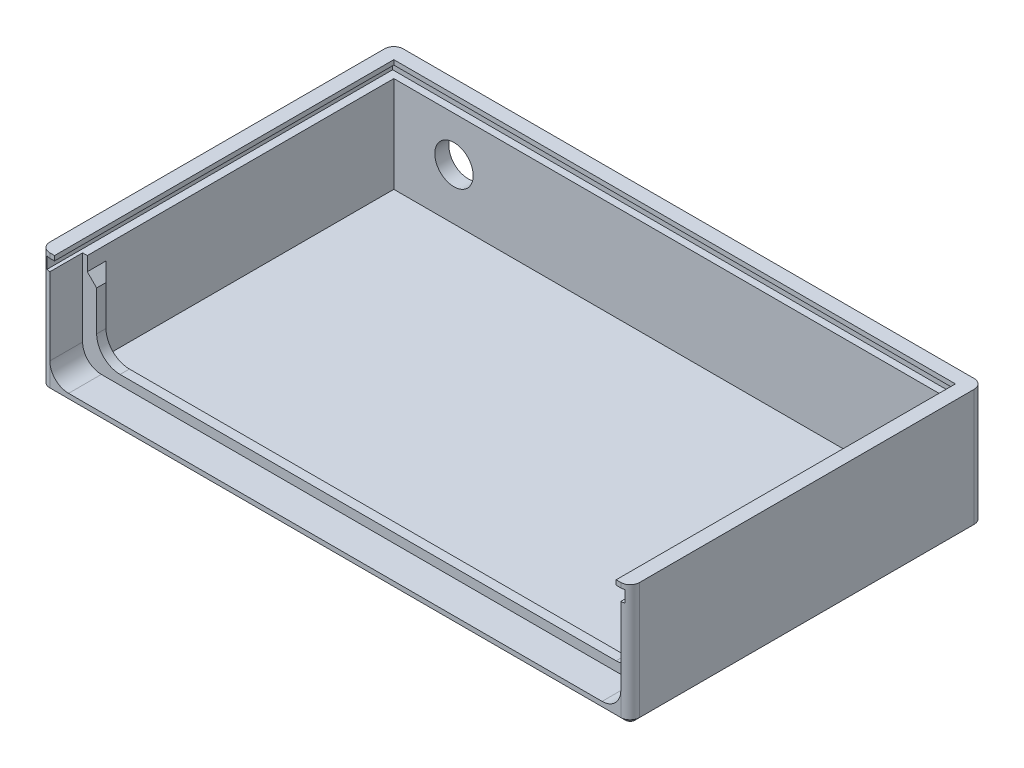
from build123d import *

# Parameters (mm, degrees)
ESQUISSE1_W                     = 126
ESQUISSE1_H                     = 75.5
BOSS_EXTRU_1_DEPTH              = 2
BOSS_EXTRU_2_DEPTH              = 24
ESQUISSE3_W                     = 123.5
ESQUISSE3_H                     = 74
ENL_V_MAT_EXTRU_1_DEPTH         = 2.5
BOSS_EXTRU_3_START              = -7
BOSS_EXTRU_3_DEPTH              = 2
ESQUISSE5_W                     = 1
ESQUISSE5_H                     = 20.5
ENL_V_MAT_EXTRU_2_DEPTH         = 7
D_POUILLE1_ANGLE                = 45
D_POUILLE1_OF_SYM_TRIE1_2_ANGLE = 45
ENL_V_MAT_EXTRU_3_REACH         = 103.712
ESQUISSE6_R                     = 4.1
CONG_1_R                        = 4
CONG_2_R                        = 2
CHANFREIN1_SIZE                 = 1
ESQUISSE7_W                     = 1.435897436
ESQUISSE7_H                     = 8
ENL_V_MAT_EXTRU_4_DEPTH         = 0.5
CHANFREIN2_SIZE                 = 2


# Some blends are built 0.0001 mm under size
with BuildPart() as part:
    # Esquisse1 → Boss.-Extru.1 (new body)
    with BuildSketch(Plane(origin=(0, 0, 0), x_dir=(1, 0, 0), z_dir=(0, 1, 0))):
        Rectangle(ESQUISSE1_W, ESQUISSE1_H)
    extrude(amount=BOSS_EXTRU_1_DEPTH)

    # Esquisse2 → Boss.-Extru.2 (add)
    with BuildSketch(Plane(origin=(0, 2, 0), x_dir=(1, 0, 0), z_dir=(0, 1, 0))):
        Polygon((-63, -37.75), (-63, 37.75), (63, 37.75), (63, -37.75), (60, -37.75), (60, 34.75), (-60, 34.75), (-60, -37.75), align=None)
    extrude(amount=BOSS_EXTRU_2_DEPTH)

    # Esquisse3 → Enlèv. mat.-Extru.1 (cut)
    with BuildSketch(Plane(origin=(0, 25, 0), x_dir=(1, 0, 0), z_dir=(0, 1, 0))):
        with Locations((0, -0.75)):
            Rectangle(ESQUISSE3_W, ESQUISSE3_H)
    extrude(amount=-ENL_V_MAT_EXTRU_1_DEPTH, mode=Mode.SUBTRACT)

    # Esquisse4 → Boss.-Extru.3 (add)
    with BuildSketch(Plane.XY.offset(37.75).offset(BOSS_EXTRU_3_START)):
        with BuildLine():
            Line((-60, 2), (-60, 17.5))
            Line((-60, 17.5), (-58, 17.5))
            Line((-58, 17.5), (-58, 9))
            ThreePointArc((-58, 9), (-56.535533906, 5.464466094), (-53, 4))
            Line((-53, 4), (0, 4))
            Line((0, 4), (0, 2))
            Line((0, 2), (-60, 2))
        make_face()
    boss_extru_3 = extrude(amount=-BOSS_EXTRU_3_DEPTH)

    # Esquisse5 → Enlèv. mat.-Extru.2 (cut)
    with BuildSketch(Plane.XY.offset(37.75)):
        with Locations((-60.5, 12.25)):
            Rectangle(ESQUISSE5_W, ESQUISSE5_H)
    enl_v_mat_extru_2 = extrude(amount=-ENL_V_MAT_EXTRU_2_DEPTH, mode=Mode.SUBTRACT)

    # Dépouille1
    d_pouille1_faces = [part.faces().sort_by_distance(p)[0] for p in [
        (-59, 17.5, 29.75),
    ]]
    draft(d_pouille1_faces, Plane(origin=(-58, 17.5, 28.75), x_dir=(0, 1, 0), z_dir=(1, 0, 0)), D_POUILLE1_ANGLE)

    # Symétrie1: Boss.-Extru.3, Enlèv. mat.-Extru.2 across plane
    add(boss_extru_3.mirror(Plane(origin=(0, 0, 0), x_dir=(0, 0, 1), z_dir=(1, 0, 0))))
    add(enl_v_mat_extru_2.mirror(Plane(origin=(0, 0, 0), x_dir=(0, 0, 1), z_dir=(1, 0, 0))), mode=Mode.SUBTRACT)

    # Dépouille1 of Sym_trie1 2
    d_pouille1_of_sym_trie1_2_faces = [part.faces().sort_by_distance(p)[0] for p in [
        (59, 17.5, 29.75),
    ]]
    draft(d_pouille1_of_sym_trie1_2_faces, Plane(origin=(58, 17.5, 28.75), x_dir=(0, 1, 0), z_dir=(-1, 0, 0)), D_POUILLE1_OF_SYM_TRIE1_2_ANGLE)

    # Esquisse6 → Enlèv. mat.-Extru.3 (cut, up to next)
    with BuildSketch(Plane(origin=(0, 0, -37.75), x_dir=(-1, 0, 0), z_dir=(0, 0, -1)), mode=Mode.PRIVATE) as enl_v_mat_extru_3_sk1:
        with Locations((47.15, 13)):
            Circle(ESQUISSE6_R)
    enl_v_mat_extru_3_tool1 = extrude(enl_v_mat_extru_3_sk1.sketch, amount=-ENL_V_MAT_EXTRU_3_REACH, mode=Mode.PRIVATE) & part.part
    add(enl_v_mat_extru_3_tool1.solids().sort_by_distance((-47.15, 13, -37.75))[0], mode=Mode.SUBTRACT)

    # Congé1
    cong_1_edges = [part.edges().sort_by_distance(p)[0] for p in [
        (61, 2, 34.25),
        (-61, 2, 34.25),
    ]]
    fillet(cong_1_edges, radius=CONG_1_R)

    # Congé2
    # the kernel refuses this fillet: 2 mm, written as the material it takes off along each edge
    with BuildSketch(Plane(origin=(-63, 31, -37.75), x_dir=(0, 0, 1), z_dir=(0, -1, 0)), Plane(origin=(-63, 31, 37.75), x_dir=(1, 0, 0), z_dir=(0, -1, 0)), Plane(origin=(63, -5, 37.75), x_dir=(-1, 0, 0), z_dir=(0, 1, 0)), Plane(origin=(63, -5, -37.75), x_dir=(0, 0, 1), z_dir=(0, 1, 0))) as cong_2_piece_1:
        with BuildLine():
            CenterArc((CONG_2_R, -CONG_2_R), CONG_2_R, 90, 90)
            Line((0, -CONG_2_R), (0, 0))
            Line((0, 0), (CONG_2_R, 0))
        make_face()
    extrude(amount=36, mode=Mode.SUBTRACT)

    # Chanfrein1
    chanfrein1_edges = [part.edges().sort_by_distance(p)[0] for p in [
        (-63, 0, 0),
        (63, 0, 0),
        (0, 0, 37.75),
        (0, 0, -37.75),
        (62.414213562, 0, -37.164213562),
        (62.414213562, 0, 37.164213562),
        (-62.414213562, 0, 37.164213562),
        (-62.414213562, 0, -37.164213562),
    ]]
    chamfer(chanfrein1_edges, length=CHANFREIN1_SIZE)

    # Esquisse7 → Enlèv. mat.-Extru.4 (cut)
    # profile 1 of 6: a face of its own
    with BuildSketch(Plane(origin=(0, 0, -37.75), x_dir=(-1, 0, 0), z_dir=(0, 0, -1))):
        with BuildLine():
            Line((37.356730769, 9.1), (33.714102564, 9.1))
            Line((33.714102564, 9.1), (33.714102564, 10.433333333))
            Line((33.714102564, 10.433333333), (36.218910256, 10.433333333))
            Line((36.218910256, 10.433333333), (36.531410256, 11.946153846))
            add(Edge.make_bspline(
                [(36.531410256, 11.946153846), (36.488833773, 11.934258819), (36.404358361, 11.910658061), (36.277741523, 11.887776157), (36.155195684, 11.872131812), (36.075259219, 11.870182715), (36.036217949, 11.869230769)],
                knots=[0, 0, 0, 0, 1.054652254, 2.092520994, 3.068380062, 4, 4, 4, 4], degree=3))
            add(Edge.make_bspline(
                [(36.036217949, 11.869230769), (35.951152034, 11.871180005), (35.783468376, 11.875022379), (35.538168463, 11.91149904), (35.303279305, 11.968948675), (35.079519689, 12.050883709), (34.867108199, 12.15752427), (34.665787349, 12.286529457), (34.475310053, 12.438125847), (34.299059989, 12.612408354), (34.137114067, 12.803774493), (33.996311325, 13.010757222), (33.876056996, 13.230405166), (33.780410861, 13.464083654), (33.704918777, 13.710325028), (33.650366511, 13.969287087), (33.618107031, 14.241276738), (33.613757038, 14.426835831), (33.611538462, 14.521474359)],
                knots=[0, 0, 0, 0, 1.01440847, 1.999622559, 2.951875003, 3.895578053, 4.836219714, 5.782137149, 6.743708247, 7.735272588, 8.734977101, 9.730283169, 10.717124674, 11.717316708, 12.737475749, 13.78628267, 14.87096371, 16, 16, 16, 16], degree=3))
            add(Edge.make_bspline(
                [(33.611538462, 14.521474359), (33.61423569, 14.617191997), (33.619558109, 14.806070878), (33.654660737, 15.083707767), (33.715573847, 15.350102599), (33.802710091, 15.60364258), (33.912669136, 15.84618458), (34.045376918, 16.078023706), (34.205799473, 16.296577848), (34.387369568, 16.501740887), (34.585480049, 16.689417979), (34.796961736, 16.854081108), (35.018239767, 16.995095781), (35.252451476, 17.106937081), (35.496013236, 17.195869357), (35.749770965, 17.260470864), (36.014819144, 17.297547665), (36.194757565, 17.302573592), (36.286217949, 17.305128205)],
                knots=[0, 0, 0, 0, 1.068252361, 2.107974174, 3.117445057, 4.112928197, 5.094821713, 6.085741881, 7.08864209, 8.115013732, 9.139860459, 10.12970393, 11.102304324, 12.062250553, 13.020362151, 13.992066755, 14.979393365, 16, 16, 16, 16], degree=3))
            add(Edge.make_bspline(
                [(36.286217949, 17.305128205), (36.36799199, 17.302969417), (36.529267512, 17.298711834), (36.76719768, 17.274341519), (36.995390922, 17.225942312), (37.216097107, 17.16517851), (37.426264805, 17.081419043), (37.630224837, 16.9851656), (37.821837302, 16.864321235), (38.006545818, 16.731193572), (38.177249589, 16.580001734), (38.335743072, 16.416624509), (38.475997296, 16.238007931), (38.603237632, 16.047623622), (38.710550731, 15.841916713), (38.80648242, 15.624587445), (38.884853003, 15.393189509), (38.924648228, 15.232793715), (38.944871795, 15.151282051)],
                knots=[0, 0, 0, 0, 1.055144606, 2.080965977, 3.079696235, 4.061281178, 5.030010203, 5.994686618, 6.966205752, 7.947572972, 8.929036963, 9.903776773, 10.879904045, 11.854643856, 12.853445432, 13.868704235, 14.916895142, 16, 16, 16, 16], degree=3))
            Line((38.944871795, 15.151282051), (37.303846154, 15.151282051))
            add(Edge.make_bspline(
                [(37.303846154, 15.151282051), (37.273862704, 15.20778795), (37.215593291, 15.317600716), (37.104497814, 15.463060755), (36.981001682, 15.588430378), (36.841822396, 15.689021011), (36.694351878, 15.769646198), (36.53826871, 15.828803733), (36.373697012, 15.862791061), (36.261263072, 15.867070019), (36.204487179, 15.869230769)],
                knots=[0, 0, 0, 0, 1.105237818, 2.14790357, 3.154462025, 4.139874369, 5.10774607, 6.055457142, 7.018062016, 8, 8, 8, 8], degree=3))
            add(Edge.make_bspline(
                [(36.204487179, 15.869230769), (36.164916494, 15.867741448), (36.087060502, 15.864811183), (35.97234664, 15.849321136), (35.862867968, 15.819945225), (35.757711891, 15.779394631), (35.656566336, 15.72815206), (35.5599408, 15.665191759), (35.468319558, 15.590909822), (35.382007933, 15.50650921), (35.304103317, 15.412176887), (35.235192219, 15.311477004), (35.176242977, 15.204497286), (35.130421826, 15.09005829), (35.093445527, 14.969432147), (35.066054036, 14.842467008), (35.049723167, 14.708871045), (35.048208532, 14.617674403), (35.047435897, 14.571153846)],
                knots=[0, 0, 0, 0, 0.978584799, 1.925382083, 2.854237347, 3.773848163, 4.706917643, 5.651871472, 6.619075428, 7.618203006, 8.630937754, 9.638147826, 10.630884984, 11.643619732, 12.679505692, 13.746568031, 14.850495961, 16, 16, 16, 16], degree=3))
            add(Edge.make_bspline(
                [(35.047435897, 14.571153846), (35.048084262, 14.525678449), (35.049347218, 14.437096436), (35.067212935, 14.307735078), (35.089600071, 14.18389614), (35.125789711, 14.066738516), (35.169943509, 13.954952988), (35.227667349, 13.851133704), (35.29032401, 13.750515153), (35.366642118, 13.660425433), (35.447268049, 13.577000872), (35.534271503, 13.504440158), (35.62572548, 13.44335686), (35.721534266, 13.393457669), (35.82080087, 13.352112104), (35.925769876, 13.326416259), (36.033886304, 13.306803055), (36.107703766, 13.305692305), (36.145192308, 13.305128205)],
                knots=[0, 0, 0, 0, 1.166510573, 2.272258428, 3.34817395, 4.393855846, 5.415148486, 6.427654656, 7.43960333, 8.452852352, 9.451798603, 10.415864797, 11.355425197, 12.269514664, 13.186377996, 14.107845883, 15.039060727, 16, 16, 16, 16], degree=3))
            add(Edge.make_bspline(
                [(36.145192308, 13.305128205), (36.185920887, 13.30663108), (36.267549696, 13.309643163), (36.388408684, 13.335439705), (36.508876077, 13.373621269), (36.627384677, 13.43063288), (36.745049016, 13.503782002), (36.862071637, 13.592158908), (36.977979167, 13.697176188), (37.051215208, 13.775715333), (37.089102564, 13.816346154)],
                knots=[0, 0, 0, 0, 0.882519632, 1.768758668, 2.670168731, 3.618680561, 4.612333577, 5.671392632, 6.795336641, 8, 8, 8, 8], degree=3))
            Line((37.089102564, 13.816346154), (38.297435897, 13.539102564))
            Line((38.297435897, 13.539102564), (37.356730769, 9.1))
        make_face()
    # profile 2 of 6: a face of its own
    with BuildSketch(Plane(origin=(0, 0, -37.75), x_dir=(-1, 0, 0), z_dir=(0, 0, -1))):
        Polygon((32.73974359, 9.1), (31.206089744, 9.1), (29.15, 14.782692308), (27.089102564, 9.1), (25.56025641, 9.1), (28.460897436, 17.1), (29.843910256, 17.1), align=None)
    # profile 3 of 6: a face of its own
    with BuildSketch(Plane(origin=(0, 0, -37.75), x_dir=(-1, 0, 0), z_dir=(0, 0, -1))):
        with BuildLine():
            Line((21.201282051, 9.1), (19.391987179, 9.1))
            add(Edge.make_bspline(
                [(19.391987179, 9.1), (19.250928398, 9.100963267), (18.97826018, 9.102825273), (18.58327372, 9.124607525), (18.215711922, 9.156593782), (17.876406268, 9.205547307), (17.564134897, 9.262365527), (17.281202856, 9.338457195), (17.025307529, 9.425778932), (16.793763304, 9.527520805), (16.582963289, 9.64684047), (16.384221103, 9.780891164), (16.195242375, 9.931683963), (16.014979821, 10.099569895), (15.842994139, 10.283432692), (15.683322548, 10.486974584), (15.530846093, 10.704923565), (15.388038718, 10.938036083), (15.260922318, 11.185851914), (15.147774471, 11.444470615), (15.053501878, 11.714060272), (14.976741786, 11.994248651), (14.91559813, 12.284224111), (14.872806328, 12.584539165), (14.846354743, 12.894924791), (14.84367125, 13.105288029), (14.842307692, 13.212179487)],
                knots=[0, 0, 0, 0, 1.44349102, 2.790284463, 4.047513061, 5.218094321, 6.297837468, 7.293772999, 8.213586047, 9.062895527, 9.878013142, 10.689252941, 11.514048747, 12.349645483, 13.208421871, 14.087867281, 14.994836234, 15.929653487, 16.883274053, 17.843080533, 18.816554169, 19.803369425, 20.81449504, 21.847452076, 22.906230055, 24, 24, 24, 24], degree=3))
            add(Edge.make_bspline(
                [(14.842307692, 13.212179487), (14.845877862, 13.363010491), (14.852905949, 13.65993015), (14.912113033, 14.095653639), (15.00785532, 14.513348388), (15.142532169, 14.909698807), (15.309306256, 15.281348776), (15.509038814, 15.620853503), (15.735992407, 15.928905025), (15.992180982, 16.200392134), (16.2691327, 16.435167669), (16.558068698, 16.633893498), (16.858730483, 16.793407194), (17.12421356, 16.893019288), (17.355068893, 16.955625897), (17.557457555, 16.991996147), (17.787793352, 17.025728063), (18.046944407, 17.054721537), (18.335679218, 17.074576338), (18.653103684, 17.088287479), (18.999294687, 17.098475729), (19.239735381, 17.099478596), (19.36474359, 17.1)],
                knots=[0, 0, 0, 0, 1.315347898, 2.589339334, 3.828278609, 5.048487211, 6.235212834, 7.375728391, 8.47833097, 9.56625089, 10.624194351, 11.640157642, 12.619895326, 13.585848527, 14.106971868, 14.704705962, 15.37825295, 16.137840974, 16.978850452, 17.902510282, 18.909488129, 20, 20, 20, 20], degree=3))
            Line((19.36474359, 17.1), (21.201282051, 17.1))
            Line((21.201282051, 17.1), (21.201282051, 9.1))
        make_face()
        with BuildLine():
            Line((19.765384615, 10.535897436), (19.765384615, 15.664102564))
            Line((19.765384615, 15.664102564), (19.015384615, 15.664102564))
            add(Edge.make_bspline(
                [(19.015384615, 15.664102564), (18.926161605, 15.66367051), (18.754582041, 15.662839652), (18.506557335, 15.65142376), (18.277664266, 15.632885708), (18.067603014, 15.605465137), (17.875890664, 15.572471171), (17.703226529, 15.531661984), (17.549270293, 15.482034905), (17.412752367, 15.42354889), (17.288114513, 15.35677413), (17.172647625, 15.278801799), (17.06120799, 15.192149814), (16.955855328, 15.094348095), (16.856197079, 14.986670444), (16.762822562, 14.868567605), (16.674480126, 14.740399688), (16.593460083, 14.601483949), (16.51935366, 14.453308792), (16.453882557, 14.297225895), (16.398612959, 14.132384365), (16.356641084, 13.958857167), (16.320886577, 13.777721114), (16.295069081, 13.587811557), (16.281003621, 13.389748942), (16.279147054, 13.254935741), (16.278205128, 13.186538462)],
                knots=[0, 0, 0, 0, 1.502729547, 2.8898115, 4.181010027, 5.369596896, 6.45687185, 7.456390247, 8.355533714, 9.177830239, 9.954819978, 10.733423081, 11.521791071, 12.330436719, 13.151797389, 13.990712567, 14.864234656, 15.771624029, 16.697123225, 17.652960569, 18.620374037, 19.622036587, 20.657870943, 21.729319508, 22.8479736, 24, 24, 24, 24], degree=3))
            add(Edge.make_bspline(
                [(16.278205128, 13.186538462), (16.280111706, 13.081729597), (16.283829385, 12.877360432), (16.319905992, 12.579732025), (16.378035933, 12.299821084), (16.462715189, 12.038346672), (16.566848532, 11.793646482), (16.699256253, 11.568873781), (16.851894569, 11.360344303), (16.972666573, 11.238036646), (17.033012821, 11.176923077)],
                knots=[0, 0, 0, 0, 1.138242922, 2.219485503, 3.251901297, 4.239342788, 5.201071, 6.134757343, 7.067992642, 8, 8, 8, 8], degree=3))
            add(Edge.make_bspline(
                [(17.033012821, 11.176923077), (17.092514979, 11.124844288), (17.214041399, 11.018479257), (17.427401857, 10.89102675), (17.662514032, 10.779047229), (17.924756586, 10.690259958), (18.21159506, 10.620043199), (18.52473787, 10.571616417), (18.862508068, 10.54049788), (19.096507392, 10.537463771), (19.217307692, 10.535897436)],
                knots=[0, 0, 0, 0, 0.813307809, 1.661089106, 2.549956539, 3.493439533, 4.508053171, 5.589449661, 6.755572447, 8, 8, 8, 8], degree=3))
            Line((19.217307692, 10.535897436), (19.765384615, 10.535897436))
        make_face(mode=Mode.SUBTRACT)
    # profile 4 of 6: a face of its own
    with BuildSketch(Plane(origin=(0, 0, -37.75), x_dir=(-1, 0, 0), z_dir=(0, 0, -1))):
        with BuildLine():
            Line((6.226923077, 10.487820513), (7.279807692, 11.494230769))
            add(Edge.make_bspline(
                [(7.279807692, 11.494230769), (7.369017984, 11.401745077), (7.543557296, 11.220797467), (7.826143158, 10.983917342), (8.116653022, 10.782598967), (8.415900017, 10.618510179), (8.72371224, 10.488287999), (9.040625228, 10.397445062), (9.365873469, 10.34024497), (9.585661669, 10.333945363), (9.696474359, 10.330769231)],
                knots=[0, 0, 0, 0, 1.115370381, 2.182214363, 3.196266025, 4.180416361, 5.141116029, 6.092551847, 7.038303877, 8, 8, 8, 8], degree=3))
            add(Edge.make_bspline(
                [(9.696474359, 10.330769231), (9.789004122, 10.333327683), (9.971601415, 10.338376508), (10.239676758, 10.375478563), (10.496201903, 10.438334239), (10.741380372, 10.525703172), (10.976424352, 10.635729955), (11.199145169, 10.774025688), (11.410739747, 10.935974584), (11.608735778, 11.121293253), (11.787483364, 11.32526574), (11.94853748, 11.540085334), (12.081937484, 11.769551672), (12.190831758, 12.010318432), (12.276642948, 12.262472556), (12.337546594, 12.526001422), (12.372834207, 12.801500032), (12.378095359, 12.988788732), (12.380769231, 13.083974359)],
                knots=[0, 0, 0, 0, 1.035268443, 2.04298821, 3.02163646, 3.985902049, 4.951223231, 5.920091634, 6.913651787, 7.92868536, 8.949353712, 9.945284791, 10.92850487, 11.913014323, 12.897904816, 13.904240668, 14.934873455, 16, 16, 16, 16], degree=3))
            add(Edge.make_bspline(
                [(12.380769231, 13.083974359), (12.379987651, 13.150780332), (12.378447141, 13.282456277), (12.362008991, 13.476741091), (12.3347092, 13.665650917), (12.296419083, 13.848626038), (12.248215086, 14.026455768), (12.189217982, 14.197981809), (12.117884815, 14.363424231), (12.038051153, 14.523649669), (11.948939732, 14.67730046), (11.849049917, 14.822339036), (11.739501045, 14.957638388), (11.624676559, 15.087906461), (11.496971887, 15.205519772), (11.362104816, 15.316960157), (11.218140264, 15.419466841), (11.06525306, 15.511613302), (10.908006713, 15.597492204), (10.743179003, 15.668610998), (10.575375862, 15.732542559), (10.401653457, 15.780638328), (10.225071902, 15.82247148), (10.043173344, 15.848020288), (9.857684069, 15.867434003), (9.732318933, 15.868629269), (9.669230769, 15.869230769)],
                knots=[0, 0, 0, 0, 1.103833241, 2.175677997, 3.219414644, 4.256521947, 5.263082927, 6.262573145, 7.25136242, 8.238376666, 9.219530388, 10.184343756, 11.145312504, 12.095474572, 13.051075647, 14.010745898, 14.985684176, 15.968306307, 16.959653902, 17.943861036, 18.93268972, 19.924626761, 20.920484516, 21.929288403, 22.957944781, 24, 24, 24, 24], degree=3))
            add(Edge.make_bspline(
                [(9.669230769, 15.869230769), (9.562220533, 15.866142538), (9.351973246, 15.860074966), (9.043450591, 15.812420272), (8.748612847, 15.734383783), (8.513500914, 15.640521186), (8.329536999, 15.549273334), (8.189559912, 15.466079872), (8.045424092, 15.371845125), (7.898116392, 15.263958642), (7.746839422, 15.143704323), (7.594191996, 15.008568702), (7.436287283, 14.862966943), (7.332844647, 14.759049584), (7.279807692, 14.705769231)],
                knots=[0, 0, 0, 0, 1.404640003, 2.759752344, 4.088613405, 5.401587939, 6.076032573, 6.783413463, 7.538272532, 8.336594406, 9.180107851, 10.074881764, 11.012956238, 12, 12, 12, 12], degree=3))
            Line((7.279807692, 14.705769231), (6.258974359, 15.777884615))
            add(Edge.make_bspline(
                [(6.258974359, 15.777884615), (6.330733447, 15.847165765), (6.47079184, 15.982387754), (6.682066052, 16.174390314), (6.893074313, 16.346926128), (7.09871935, 16.506256701), (7.302368969, 16.64774306), (7.504004603, 16.771517046), (7.701333104, 16.880742219), (7.898489144, 16.973461505), (8.097037763, 17.05269227), (8.301237327, 17.119511581), (8.511185404, 17.17784026), (8.728620793, 17.223741922), (8.952573318, 17.261109052), (9.183762617, 17.285800429), (9.4211085, 17.302922346), (9.58159228, 17.304386918), (9.662820513, 17.305128205)],
                knots=[0, 0, 0, 0, 1.244537013, 2.429070097, 3.56066612, 4.644477994, 5.67429546, 6.652817684, 7.595405349, 8.486886006, 9.369351459, 10.26090686, 11.166404474, 12.086719576, 13.0323422, 13.998023148, 14.9867073, 16, 16, 16, 16], degree=3))
            add(Edge.make_bspline(
                [(9.662820513, 17.305128205), (9.812020965, 17.301318066), (10.103964776, 17.293862684), (10.531842067, 17.238813508), (10.938651229, 17.14591522), (11.325123236, 17.016316299), (11.690075322, 16.848032792), (12.034651985, 16.64384009), (12.358279395, 16.401800187), (12.658172774, 16.125519253), (12.929355609, 15.820325962), (13.169320794, 15.492757665), (13.366946962, 15.14046201), (13.534622609, 14.770985398), (13.660270035, 14.378551482), (13.751730286, 13.966706355), (13.807383373, 13.533682649), (13.813531223, 13.237986461), (13.816666667, 13.087179487)],
                knots=[0, 0, 0, 0, 1.07798487, 2.109316747, 3.111276023, 4.08905949, 5.049398091, 6.009992678, 6.978127636, 7.964347882, 8.951383687, 9.924270623, 10.892397886, 11.86520058, 12.851549246, 13.863953586, 14.910602472, 16, 16, 16, 16], degree=3))
            add(Edge.make_bspline(
                [(13.816666667, 13.087179487), (13.815297273, 12.98882865), (13.81258347, 12.793921327), (13.785829887, 12.506062494), (13.744788723, 12.226616271), (13.686377511, 11.955926354), (13.613750922, 11.693055493), (13.521307776, 11.439193885), (13.414234874, 11.192951802), (13.289228419, 10.956624013), (13.149102854, 10.729911873), (12.995907718, 10.513388437), (12.82669297, 10.309207361), (12.643066625, 10.116475619), (12.446554791, 9.933947526), (12.235235595, 9.762918499), (12.008906978, 9.604491462), (11.769877566, 9.458536212), (11.522697955, 9.324496463), (11.267192477, 9.212104467), (11.008340439, 9.112889589), (10.744387976, 9.032751567), (10.474754122, 8.972303257), (10.201497862, 8.926687019), (9.922386507, 8.901156618), (9.734984096, 8.896980082), (9.640384615, 8.894871795)],
                knots=[0, 0, 0, 0, 1.07193642, 2.124315995, 3.14887099, 4.149444713, 5.141371803, 6.119544533, 7.092241254, 8.06650569, 9.031360777, 9.996057679, 10.955696533, 11.919602115, 12.89624813, 13.877605408, 14.880920851, 15.905674436, 16.929600311, 17.943674756, 18.946313929, 19.950355855, 20.947755382, 21.956851243, 22.968632213, 24, 24, 24, 24], degree=3))
            add(Edge.make_bspline(
                [(9.640384615, 8.894871795), (9.559682171, 8.896081836), (9.399116362, 8.898489337), (9.160000338, 8.918523009), (8.922822828, 8.950075019), (8.688308098, 8.997347624), (8.455401547, 9.054596925), (8.225078294, 9.125112609), (7.997973462, 9.211125217), (7.772118232, 9.306273312), (7.552016949, 9.414594479), (7.339582443, 9.535838799), (7.13428834, 9.666834406), (6.937372221, 9.809834445), (6.747447122, 9.962738431), (6.564715689, 10.125541303), (6.390931369, 10.301196263), (6.281868884, 10.425297942), (6.226923077, 10.487820513)],
                knots=[0, 0, 0, 0, 0.996333415, 1.982307736, 2.96084097, 3.949129141, 4.93457382, 5.921430247, 6.92116383, 7.931890485, 8.946633814, 9.948019707, 10.950686436, 11.952094051, 12.951305284, 13.960287133, 14.972390273, 16, 16, 16, 16], degree=3))
        make_face()
    # profile 5 of 6: a face of its own
    with BuildSketch(Plane(origin=(0, 0, -37.75), x_dir=(-1, 0, 0), z_dir=(0, 0, -1))):
        with Locations((1.201282051, 13.1)):
            Rectangle(ESQUISSE7_W, ESQUISSE7_H)
    # profile 6 of 6: a face of its own
    with BuildSketch(Plane(origin=(0, 0, -37.75), x_dir=(-1, 0, 0), z_dir=(0, 0, -1))):
        Polygon((-1.362820513, 9.1), (-2.656089744, 9.1), (-6.285897436, 14.364423077), (-6.285897436, 9.1), (-7.721794872, 9.1), (-7.721794872, 17.1), (-6.418910256, 17.1), (-2.798717949, 11.851602564), (-2.798717949, 17.1), (-1.362820513, 17.1), align=None)
    extrude(amount=-ENL_V_MAT_EXTRU_4_DEPTH, mode=Mode.SUBTRACT)

    # Chanfrein2
    chanfrein2_edges = [part.edges().sort_by_distance(p)[0] for p in [
        (60, 10.75, 28.75),
        (-60, 10.75, 28.75),
        (0, 2, 28.75),
    ]]
    chamfer(chanfrein2_edges, length=CHANFREIN2_SIZE - 0.0001)  # a hair under: the kernel refuses the full size


solid = part.part
